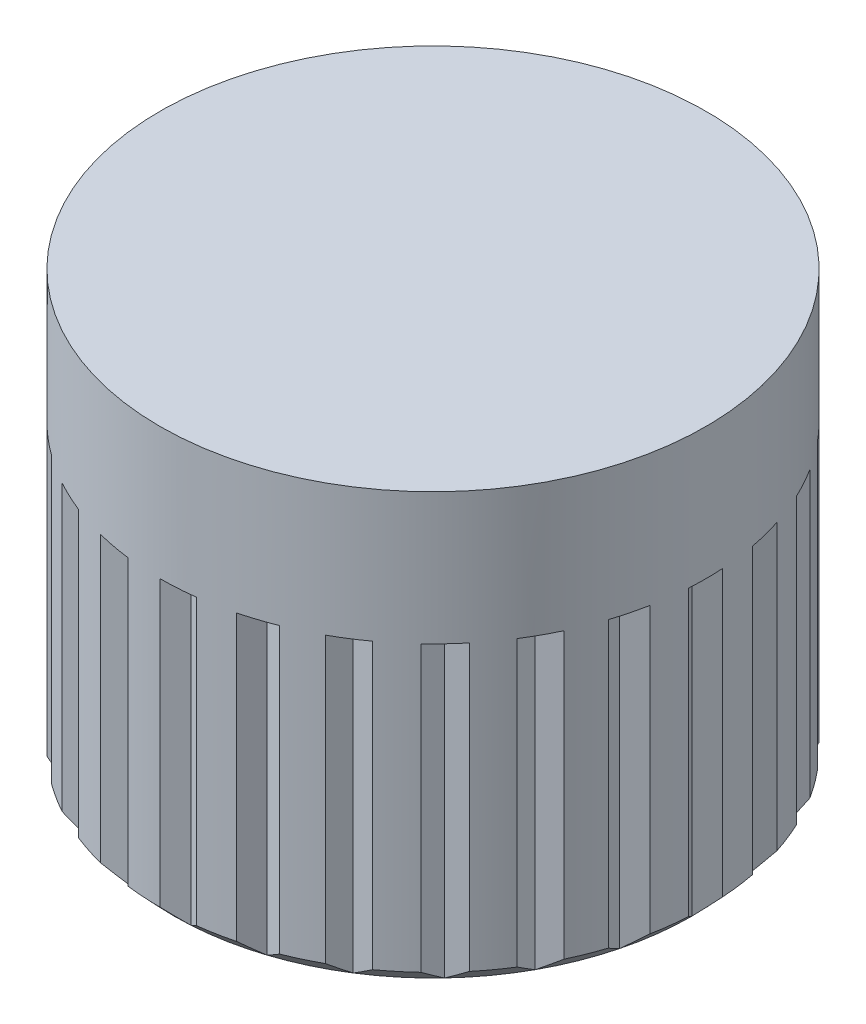
from build123d import *

# Parameters (mm, degrees)
SKETCH1_R           = 1.25
BOSS_EXTRUDE1_DEPTH = 3.18
THREAD1_PITCH       = 0.352777778
SKETCH6_R           = 2.9
BOSS_EXTRUDE2_DEPTH = 1.4


with BuildPart() as part:
    # Sketch1 → Boss-Extrude1 (new body)
    with BuildSketch(Plane(origin=(0, 0, 0), x_dir=(1, 0, 0), z_dir=(0, 1, 0))):
        with BuildLine():
            Line((0.721200673, 2.808891167), (0.849796735, 2.61540542))
            Line((0.849796735, 2.61540542), (1.067561203, 2.696351809))
            ThreePointArc((1.067561203, 2.696351809), (1.234759946, 2.623998452), (1.397085655, 2.541289372))
            Line((1.397085655, 2.541289372), (1.473523686, 2.321901795))
            Line((1.473523686, 2.321901795), (1.704577232, 2.346149284))
            ThreePointArc((1.704577232, 2.346149284), (1.84852957, 2.234488404), (1.985186607, 2.11400902))
            Line((1.985186607, 2.11400902), (2.004663725, 1.882504541))
            Line((2.004663725, 1.882504541), (2.234488404, 1.84852957))
            ThreePointArc((2.234488404, 1.84852957), (2.346149284, 1.704577232), (2.448550984, 1.553897705))
            Line((2.448550984, 1.553897705), (2.40984337, 1.324822604))
            Line((2.40984337, 1.324822604), (2.623998452, 1.234759946))
            ThreePointArc((2.623998452, 1.234759946), (2.696351809, 1.067561203), (2.758063897, 0.896149284))
            Line((2.758063897, 0.896149284), (2.663603693, 0.68389719))
            Line((2.663603693, 0.68389719), (2.848633027, 0.543405812))
            ThreePointArc((2.848633027, 0.543405812), (2.877132634, 0.363466377), (2.894277512, 0.182092507))
            Line((2.894277512, 0.182092507), (2.75, 0))
            Line((2.75, 0), (2.894277512, -0.182092507))
            ThreePointArc((2.894277512, -0.182092507), (2.877132634, -0.363466377), (2.848633027, -0.543405812))
            Line((2.848633027, -0.543405812), (2.663603693, -0.68389719))
            Line((2.663603693, -0.68389719), (2.758063897, -0.896149284))
            ThreePointArc((2.758063897, -0.896149284), (2.696351809, -1.067561203), (2.623998452, -1.234759946))
            Line((2.623998452, -1.234759946), (2.40984337, -1.324822604))
            Line((2.40984337, -1.324822604), (2.448550984, -1.553897705))
            ThreePointArc((2.448550984, -1.553897705), (2.346149284, -1.704577232), (2.234488404, -1.84852957))
            Line((2.234488404, -1.84852957), (2.004663725, -1.882504541))
            Line((2.004663725, -1.882504541), (1.985186607, -2.11400902))
            ThreePointArc((1.985186607, -2.11400902), (1.84852957, -2.234488404), (1.704577232, -2.346149284))
            Line((1.704577232, -2.346149284), (1.473523686, -2.321901795))
            Line((1.473523686, -2.321901795), (1.397085655, -2.541289372))
            ThreePointArc((1.397085655, -2.541289372), (1.234759946, -2.623998452), (1.067561203, -2.696351809))
            Line((1.067561203, -2.696351809), (0.849796735, -2.61540542))
            Line((0.849796735, -2.61540542), (0.721200673, -2.808891167))
            ThreePointArc((0.721200673, -2.808891167), (0.543405812, -2.848633027), (0.363466377, -2.877132634))
            Line((0.363466377, -2.877132634), (0.172673929, -2.744573503))
            Line((0.172673929, -2.744573503), (0, -2.9))
            ThreePointArc((0, -2.9), (-0.182092507, -2.894277512), (-0.363466377, -2.877132634))
            Line((-0.363466377, -2.877132634), (-0.515298615, -2.70128994))
            Line((-0.515298615, -2.70128994), (-0.721200673, -2.808891167))
            ThreePointArc((-0.721200673, -2.808891167), (-0.896149284, -2.758063897), (-1.067561203, -2.696351809))
            Line((-1.067561203, -2.696351809), (-1.170893052, -2.488274394))
            Line((-1.170893052, -2.488274394), (-1.397085655, -2.541289372))
            ThreePointArc((-1.397085655, -2.541289372), (-1.553897705, -2.448550984), (-1.704577232, -2.346149284))
            Line((-1.704577232, -2.346149284), (-1.752915972, -2.118911418))
            Line((-1.752915972, -2.118911418), (-1.985186607, -2.11400902))
            ThreePointArc((-1.985186607, -2.11400902), (-2.11400902, -1.985186607), (-2.234488404, -1.84852957))
            Line((-2.234488404, -1.84852957), (-2.224796735, -1.616409444))
            Line((-2.224796735, -1.616409444), (-2.448550984, -1.553897705))
            ThreePointArc((-2.448550984, -1.553897705), (-2.541289372, -1.397085655), (-2.623998452, -1.234759946))
            Line((-2.623998452, -1.234759946), (-2.556885336, -1.01234252))
            Line((-2.556885336, -1.01234252), (-2.758063897, -0.896149284))
            ThreePointArc((-2.758063897, -0.896149284), (-2.808891167, -0.721200673), (-2.848633027, -0.543405812))
            Line((-2.848633027, -0.543405812), (-2.728315429, -0.344666392))
            Line((-2.728315429, -0.344666392), (-2.894277512, -0.182092507))
            ThreePointArc((-2.894277512, -0.182092507), (-2.9, 0), (-2.894277512, 0.182092507))
            Line((-2.894277512, 0.182092507), (-2.728315429, 0.344666392))
            Line((-2.728315429, 0.344666392), (-2.848633027, 0.543405812))
            ThreePointArc((-2.848633027, 0.543405812), (-2.808891167, 0.721200673), (-2.758063897, 0.896149284))
            Line((-2.758063897, 0.896149284), (-2.556885336, 1.01234252))
            Line((-2.556885336, 1.01234252), (-2.623998452, 1.234759946))
            ThreePointArc((-2.623998452, 1.234759946), (-2.541289372, 1.397085655), (-2.448550984, 1.553897705))
            Line((-2.448550984, 1.553897705), (-2.224796735, 1.616409444))
            Line((-2.224796735, 1.616409444), (-2.234488404, 1.84852957))
            ThreePointArc((-2.234488404, 1.84852957), (-2.11400902, 1.985186607), (-1.985186607, 2.11400902))
            Line((-1.985186607, 2.11400902), (-1.752915972, 2.118911418))
            Line((-1.752915972, 2.118911418), (-1.704577232, 2.346149284))
            ThreePointArc((-1.704577232, 2.346149284), (-1.553897705, 2.448550984), (-1.397085655, 2.541289372))
            Line((-1.397085655, 2.541289372), (-1.170893052, 2.488274394))
            Line((-1.170893052, 2.488274394), (-1.067561203, 2.696351809))
            ThreePointArc((-1.067561203, 2.696351809), (-0.896149284, 2.758063897), (-0.721200673, 2.808891167))
            Line((-0.721200673, 2.808891167), (-0.515298615, 2.70128994))
            Line((-0.515298615, 2.70128994), (-0.363466377, 2.877132634))
            ThreePointArc((-0.363466377, 2.877132634), (-0.182092507, 2.894277512), (0, 2.9))
            Line((0, 2.9), (0.172673929, 2.744573503))
            Line((0.172673929, 2.744573503), (0.363466377, 2.877132634))
            ThreePointArc((0.363466377, 2.877132634), (0.543405812, 2.848633027), (0.721200673, 2.808891167))
        make_face()
        with Locations(Location((0, 0, 0), (0, 0, 90))):
            Circle(SKETCH1_R, mode=Mode.SUBTRACT)
    extrude(amount=BOSS_EXTRUDE1_DEPTH)

    # Sketch2 → Cut-Revolve1 (revolve, cut)
    with BuildSketch(Plane(origin=(0, 0, 0), x_dir=(0, 0, -1), z_dir=(1, 0, 0))):
        Polygon((-2.75, 0), (-2.9, 0), (-2.9, 0.158446691), align=None)
    revolve(axis=Axis((0, 0, 0), (0, 1, 0)), mode=Mode.SUBTRACT)

    # Thread1: the profile of Thread Profile1 profile screwed along a right-hand helix of 11.848819 turns, 6 arcs to a turn; built about Z, then put on its axis
    thread1_z = Axis((0, 0, 0), (0, 0, 1))
    thread1_corners = [(1.2497, 0, -0.000173205), (1.440946573, 0, 0.110243055), (1.440946573, 0, 0.154340277), (1.2497, 0, 0.264756537)]
    with BuildLine(mode=Mode.PRIVATE) as thread1_profile:
        Line(thread1_corners[0], thread1_corners[1])
        Line(thread1_corners[1], thread1_corners[2])
        Line(thread1_corners[2], thread1_corners[3])
        Line(thread1_corners[3], thread1_corners[0])
    thread1_cap = Face(thread1_profile.wire())
    thread1_turn_angles = [0, 30, 60, 90, 120, 150, 180, 210, 240, 270, 300, 330, 360]
    thread1_turn_weights = [1, 0.8660254037844387, 1, 0.8660254037844387, 1, 0.8660254037844387, 1, 0.8660254037844387, 1, 0.8660254037844387, 1, 0.8660254037844387, 1]
    thread1_turn_rails = [Edge.make_bspline([Vector(p[0], p[1], 0).rotate(thread1_z, thread1_turn_angles[k]) / thread1_turn_weights[k] + Vector(0, 0, p[2] + THREAD1_PITCH * thread1_turn_angles[k] / 360) for k in range(13)], [0, 0, 0, 1, 1, 2, 2, 3, 3, 4, 4, 5, 5, 6, 6, 6], 2, thread1_turn_weights) for p in thread1_corners]
    thread1_turn_sides = [Face.make_surface_from_curves(thread1_turn_rails[p[0]], thread1_turn_rails[p[1]]) for p in [(0, 1), (1, 2), (2, 3), (3, 0)]]
    thread1_last_angles = [3960, 3990, 4020, 4050, 4080, 4110, 4140, 4170, 4200, 4230, 4260, 4262.787401575, 4265.57480315]
    thread1_last_weights = [1, 0.8660254037844387, 1, 0.8660254037844387, 1, 0.8660254037844387, 1, 0.8660254037844387, 1, 0.8660254037844387, 1, 0.9988168544785155, 1]
    thread1_last_rails = [Edge.make_bspline([Vector(p[0], p[1], 0).rotate(thread1_z, thread1_last_angles[k]) / thread1_last_weights[k] + Vector(0, 0, p[2] + THREAD1_PITCH * thread1_last_angles[k] / 360) for k in range(13)], [0, 0, 0, 1, 1, 2, 2, 3, 3, 4, 4, 5, 5, 6, 6, 6], 2, thread1_last_weights) for p in thread1_corners]
    thread1_last_sides = [Face.make_surface_from_curves(thread1_last_rails[p[0]], thread1_last_rails[p[1]]) for p in [(0, 1), (1, 2), (2, 3), (3, 0)]]
    thread1 = Plane(origin=(0, -1, 0), x_dir=(1, 0, 0), z_dir=(0, 1, 0)) * Solid(Shell([*[p.moved(Location((0, 0, THREAD1_PITCH * i))) for i in range(11) for p in thread1_turn_sides], *thread1_last_sides, thread1_cap, thread1_cap.rotate(thread1_z, 4265.57480315).moved(Location((0, 0, THREAD1_PITCH * 4265.57480315 / 360)))]))
    add(thread1, mode=Mode.SUBTRACT)

    # Sketch6 → Boss-Extrude2 (add)
    with BuildSketch(Plane(origin=(0, 3.18, 0), x_dir=(1, 0, 0), z_dir=(0, 1, 0))):
        with Locations(Location((0, 0, 0), (0, 0, 270))):
            Circle(SKETCH6_R)
    extrude(amount=BOSS_EXTRUDE2_DEPTH)


solid = part.part
